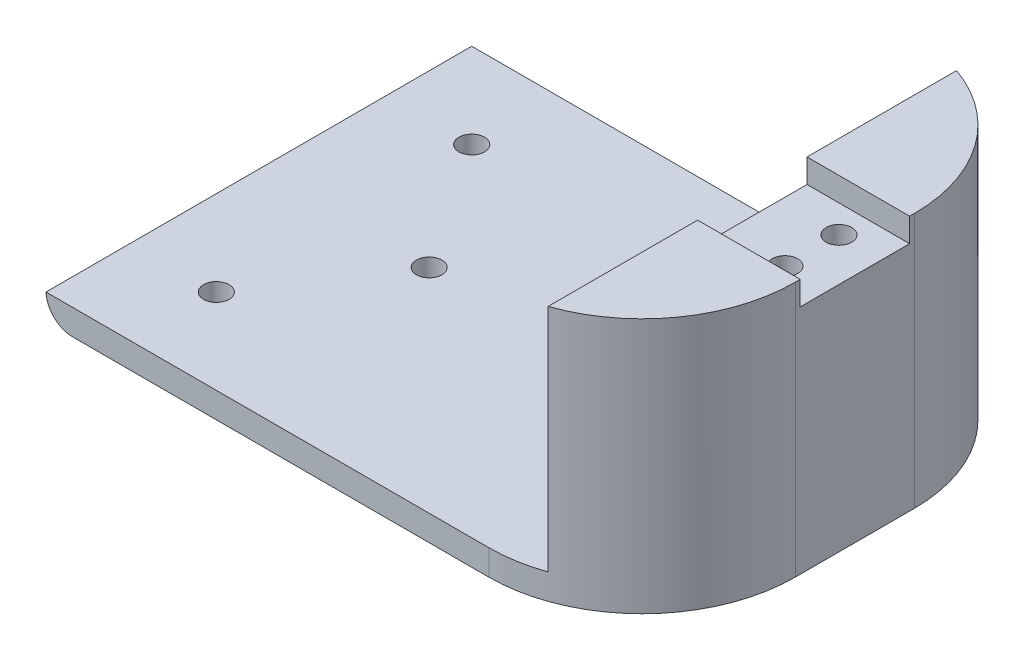
from build123d import *

# Parameters (mm, degrees)
BOSS_EXTRUDE1_DEPTH                        = 50
MOUNTHOLESSKETCH2_R                        = 1.5
MOUNTHOLESSKETCH2_R_2                      = 9
MOUNTHOLESCUT_EXTRUDE1_DEPTH               = 91.160967164
MICROSWITCHCUTSKETCH3_W                    = 12.05
MICROSWITCHCUTSKETCH3_H                    = 12.85
MICROSWITCHCUT_EXTRUDE2_DEPTH              = 2.8
MICROSWITCHMOUNTINGHOLESSKETCH4_R          = 1.5
MICROSWITCHMOUNTINGHOLESCUT_EXTRUDE3_DEPTH = 3
RAILEDGEFILLET1_R                          = 3.125
FRONTEDGEFILLET1_R                         = 18


with BuildPart() as part:
    # ProfileSketch1 → Boss-Extrude1 (new body)
    with BuildSketch(Plane.XY):
        Polygon((70, 0), (70, -3), (0, -3), (0, 0), (57.95, 0), (57.95, 27), (70, 27), align=None)
    extrude(amount=BOSS_EXTRUDE1_DEPTH)

    # MountHolesSketch2 → MountHolesCut-Extrude1 (cut, through all)
    with BuildSketch(Plane(origin=(0, 0, 0), x_dir=(1, 0, 0), z_dir=(0, 1, 0))):
        with Locations(Location((10, -10, 0), (0, 0, 270))):
            Circle(MOUNTHOLESSKETCH2_R)
        with Locations(Location((10, -40, 0), (0, 0, 270))):
            Circle(MOUNTHOLESSKETCH2_R)
        with Locations(Location((47.95, -25, 0), (0, 0, 270))):
            Circle(MOUNTHOLESSKETCH2_R_2)
        with Locations(Location((20, -25, 0), (0, 0, 270))):
            Circle(MOUNTHOLESSKETCH2_R)
    extrude(amount=-MOUNTHOLESCUT_EXTRUDE1_DEPTH, mode=Mode.SUBTRACT)

    # MicroSwitchCutSketch3 → MicroSwitchCut-Extrude2 (cut)
    with BuildSketch(Plane(origin=(0, 27, 0), x_dir=(1, 0, 0), z_dir=(0, 1, 0))):
        with Locations((63.975, -25)):
            Rectangle(MICROSWITCHCUTSKETCH3_W, MICROSWITCHCUTSKETCH3_H)
    extrude(amount=-MICROSWITCHCUT_EXTRUDE2_DEPTH, mode=Mode.SUBTRACT)

    # MicroSwitchMountingHolesSketch4 → MicroSwitchMountingHolesCut-Extrude3 (cut)
    with BuildSketch(Plane(origin=(0, 24.2, 0), x_dir=(1, 0, 0), z_dir=(0, 1, 0))):
        with Locations(Location((64.95, -28.175, 0), (0, 0, 180))):
            Circle(MICROSWITCHMOUNTINGHOLESSKETCH4_R)
        with Locations(Location((64.95, -21.825, 0), (0, 0, 180))):
            Circle(MICROSWITCHMOUNTINGHOLESSKETCH4_R)
    extrude(amount=-MICROSWITCHMOUNTINGHOLESCUT_EXTRUDE3_DEPTH, mode=Mode.SUBTRACT)

    # RailEdgeFillet1
    # the kernel refuses this fillet: 3.125 mm, written as the material it takes off along each edge
    with BuildSketch(Plane(origin=(0, -3, -7.806247498), x_dir=(1, 0, 0), z_dir=(0, 0, 1))) as railedgefillet1_piece_1:
        with BuildLine():
            CenterArc((3.122498999, 3.125), RAILEDGEFILLET1_R, 182.292442776, 87.707557224)
            Line((0, 3), (-0.06244998, 2.9975))
            ThreePointArc((-0.06244998, 2.9975), (-0.0625, 1.5), (-0.0625, 0))
            Line((-0.0625, 0), (0, -0.0625))
            Line((0, -0.0625), (3.122498999, -0.0625))
            Line((3.122498999, -0.0625), (3.122498999, 0))
        make_face()
    extrude(amount=65.612494996, mode=Mode.SUBTRACT)

    # FrontEdgeFillet1
    frontedgefillet1_edges = [part.edges().sort_by_distance(p)[0] for p in [
        (70, 12, 0),
        (70, 12, 50),
    ]]
    fillet(frontedgefillet1_edges, radius=FRONTEDGEFILLET1_R)


solid = part.part
